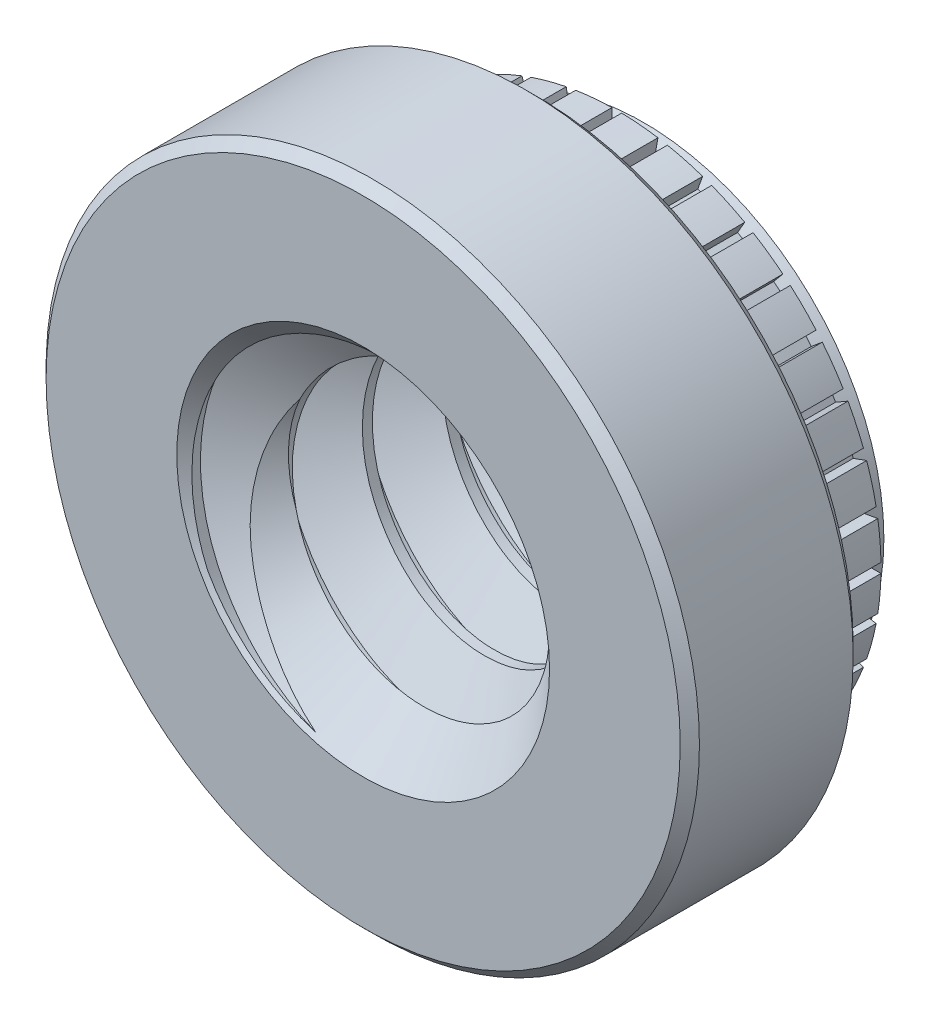
from build123d import *

# Parameters (mm, degrees)
SKETCH1_R               = 4.318
EXTRUDE1_DEPTH          = 2.286
SKETCH2_R               = 3.4925
EXTRUDE2_DEPTH          = 1.4224
SKETCH3_W               = 0.127
SKETCH3_H               = 1.016
CUT_EXTRUDE_THIN1_DEPTH = 1.4224
CIRPATTERN1_COUNT       = 36
SKETCH5_OUTSIDE_W       = 13.448
SKETCH5_OUTSIDE_H       = 13.448
SKETCH5_OUTSIDE_R       = 3.175
CUT_EXTRUDE1_DEPTH      = 0.3556
CUT_EXTRUDE1_DRAFT      = 20
CHAMFER2_SIZE           = 0.127
SKETCH7_R               = 2.413
CUT_EXTRUDE3_DEPTH      = 8.144401904
SWEEP1_PITCH            = 1.058333333
SKETCH10_R              = 4.318
CUT_EXTRUDE4_DEPTH      = 8.666153138
SKETCH11_R              = 3.175
CUT_EXTRUDE5_DEPTH      = 8.144401955


with BuildPart() as part:
    # Sketch1 → Extrude1 (new body)
    with BuildSketch(Plane.XY):
        Circle(SKETCH1_R)
    extrude(amount=-EXTRUDE1_DEPTH)

    # Sketch2 → Extrude2 (add)
    with BuildSketch(Plane(origin=(0, 0, -2.286), x_dir=(-1, 0, 0), z_dir=(0, 0, -1))):
        with Locations(Location((0, 0, 0), (0, 0, 180))):
            Circle(SKETCH2_R)
    extrude(amount=EXTRUDE2_DEPTH)

    # Sketch3 → Cut-Extrude-Thin1 (cut)
    with BuildSketch(Plane(origin=(0, 0, -3.7084), x_dir=(-1, 0, 0), z_dir=(0, 0, -1))):
        with Locations((0, 3.81)):
            Rectangle(SKETCH3_W, SKETCH3_H)
    cut_extrude_thin1 = extrude(amount=-CUT_EXTRUDE_THIN1_DEPTH, mode=Mode.SUBTRACT)

    # CirPattern1: Cut-Extrude-Thin1 ×36 about axis
    cirpattern1_axis = Axis((0, 0, 0), (0, 0, 1))
    for i in range(1, CIRPATTERN1_COUNT):
        add(cut_extrude_thin1.rotate(cirpattern1_axis, i * 360 / CIRPATTERN1_COUNT), mode=Mode.SUBTRACT)


with BuildPart() as cut_extrude1_tool:
    # Sketch5 outside → Cut-Extrude1 (with draft: the straight prism first)
    with BuildSketch(Plane(origin=(0, 0, -3.7084), x_dir=(-1, 0, 0), z_dir=(0, 0, -1))):
        Rectangle(SKETCH5_OUTSIDE_W, SKETCH5_OUTSIDE_H)
        Circle(SKETCH5_OUTSIDE_R, mode=Mode.SUBTRACT)
    extrude(amount=-CUT_EXTRUDE1_DEPTH)
    # Cut-Extrude1: the draft: its side faces are tilted about the plane it starts from
    cut_extrude1_sides = [cut_extrude1_tool.faces().sort_by_distance(p)[0] for p in [
        (0, -6.724, -3.5306),
        (-6.724, 0, -3.5306),
        (0, 6.724, -3.5306),
        (6.724, 0, -3.5306),
        (3.175, 0, -3.5306),
    ]]
    draft(cut_extrude1_sides, Plane(origin=(0, 0, -3.7084), x_dir=(-1, 0, 0), z_dir=(0, 0, -1)), CUT_EXTRUDE1_DRAFT)


with BuildPart() as part_1:
    add(part.part)

    # Cut-Extrude1: cut by cut_extrude1_tool
    add(cut_extrude1_tool.part, mode=Mode.SUBTRACT)

    # Chamfer2
    chamfer2_edges = [part_1.edges().sort_by_distance(p)[0] for p in [
        (-4.318, 0, 0),
        (-4.318, 0, -2.286),
    ]]
    chamfer(chamfer2_edges, length=CHAMFER2_SIZE)

    # Sketch7 → Cut-Extrude3 (cut, through all)
    with BuildSketch(Plane.XY):
        Circle(SKETCH7_R)
    extrude(amount=-CUT_EXTRUDE3_DEPTH, mode=Mode.SUBTRACT)

    # Sweep1: the profile of Sketch9 profile screwed along a right-hand helix of 6.504 turns, 6 arcs to a turn; built about Z, then put on its axis
    sweep1_z = Axis((0, 0, 0), (0, 0, 1))
    sweep1_corners = [(2.4133, 0, -0.926214872), (1.725592336, 0, -0.529166667), (1.725592336, 0, -0.396875), (2.4133, 0, 0.000173205)]
    with BuildLine(mode=Mode.PRIVATE) as sweep1_profile:
        Line(sweep1_corners[0], sweep1_corners[1])
        Line(sweep1_corners[1], sweep1_corners[2])
        Line(sweep1_corners[2], sweep1_corners[3])
        Line(sweep1_corners[3], sweep1_corners[0])
    sweep1_cap = Face(sweep1_profile.wire())
    sweep1_turn_angles = [0, 30, 60, 90, 120, 150, 180, 210, 240, 270, 300, 330, 360]
    sweep1_turn_weights = [1, 0.8660254037844387, 1, 0.8660254037844387, 1, 0.8660254037844387, 1, 0.8660254037844387, 1, 0.8660254037844387, 1, 0.8660254037844387, 1]
    sweep1_turn_rails = [Edge.make_bspline([Vector(p[0], p[1], 0).rotate(sweep1_z, sweep1_turn_angles[k]) / sweep1_turn_weights[k] + Vector(0, 0, p[2] + SWEEP1_PITCH * sweep1_turn_angles[k] / 360) for k in range(13)], [0, 0, 0, 1, 1, 2, 2, 3, 3, 4, 4, 5, 5, 6, 6, 6], 2, sweep1_turn_weights) for p in sweep1_corners]
    sweep1_turn_sides = [Face.make_surface_from_curves(sweep1_turn_rails[p[0]], sweep1_turn_rails[p[1]]) for p in [(0, 1), (1, 2), (2, 3), (3, 0)]]
    sweep1_last_angles = [2160, 2190, 2220, 2250, 2280, 2310, 2340, 2340.72, 2341.44]
    sweep1_last_weights = [1, 0.8660254037844387, 1, 0.8660254037844387, 1, 0.8660254037844387, 1, 0.9999210442038159, 1]
    sweep1_last_rails = [Edge.make_bspline([Vector(p[0], p[1], 0).rotate(sweep1_z, sweep1_last_angles[k]) / sweep1_last_weights[k] + Vector(0, 0, p[2] + SWEEP1_PITCH * sweep1_last_angles[k] / 360) for k in range(9)], [0, 0, 0, 1, 1, 2, 2, 3, 3, 4, 4, 4], 2, sweep1_last_weights) for p in sweep1_corners]
    sweep1_last_sides = [Face.make_surface_from_curves(sweep1_last_rails[p[0]], sweep1_last_rails[p[1]]) for p in [(0, 1), (1, 2), (2, 3), (3, 0)]]
    sweep1 = Plane(origin=(0, 0, -3.7084), x_dir=(0, 1, 0), z_dir=(0, 0, 1)) * Solid(Shell([*[p.moved(Location((0, 0, SWEEP1_PITCH * i))) for i in range(6) for p in sweep1_turn_sides], *sweep1_last_sides, sweep1_cap, sweep1_cap.rotate(sweep1_z, 2341.44).moved(Location((0, 0, SWEEP1_PITCH * 2341.44 / 360)))]))
    add(sweep1)

    # Sketch10 → Cut-Extrude4 (cut, through all)
    with BuildSketch(Plane.XY):
        Circle(SKETCH10_R)
    extrude(amount=CUT_EXTRUDE4_DEPTH, mode=Mode.SUBTRACT)

    # Sketch11 → Cut-Extrude5 (cut, through all)
    with BuildSketch(Plane(origin=(0, 0, -3.7084), x_dir=(-1, 0, 0), z_dir=(0, 0, -1))):
        Circle(SKETCH11_R)
    extrude(amount=CUT_EXTRUDE5_DEPTH, mode=Mode.SUBTRACT)

    # Cut-Extrude6 cone 1 section (through the dimple's axis) → Cut-Extrude6 (revolve, cut)
    with BuildSketch(Plane(origin=(0, 0, 0), x_dir=(0, -1, 0), z_dir=(1, 0, 0))):
        Polygon((0, 0), (2.4638, 0), (0, 2.4638), align=None)
    revolve(axis=Axis((0, 0, 0), (0, 0, -1)), mode=Mode.SUBTRACT)

    # Cut-Extrude7 cone 1 section (through the dimple's axis) → Cut-Extrude7 (revolve, cut)
    with BuildSketch(Plane(origin=(0, 0, -3.7084), x_dir=(0, 1, 0), z_dir=(1, 0, 0))):
        Polygon((0, 0), (2.4638, 0), (0, 2.4638), align=None)
    revolve(axis=Axis((0, 0, -3.7084), (0, 0, 1)), mode=Mode.SUBTRACT)


solid = part_1.part
